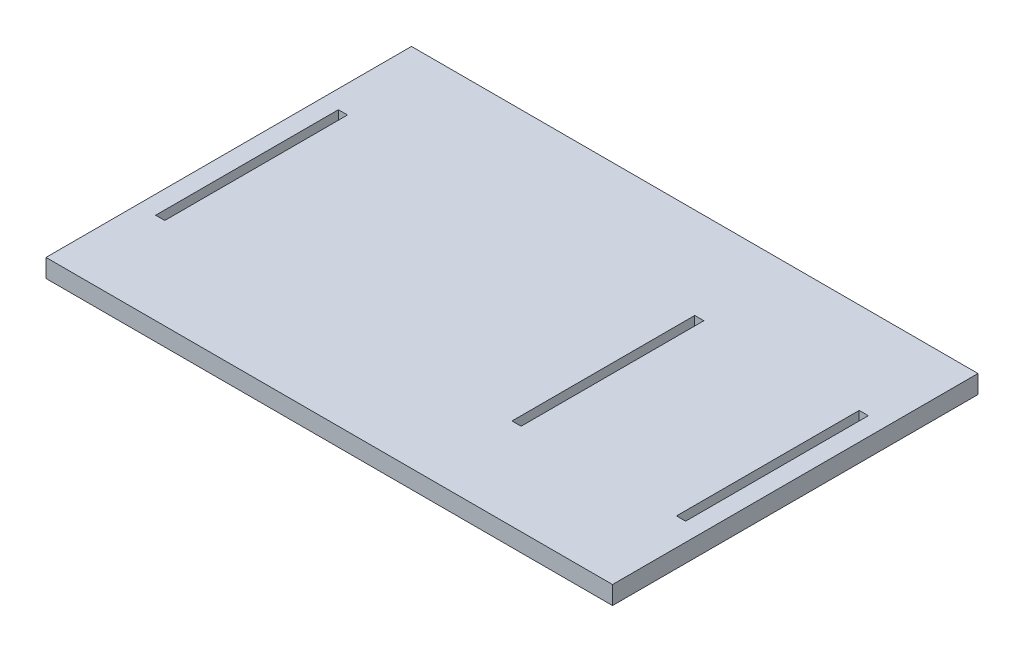
from build123d import *

# Parameters (mm, degrees)
CROQUIS1_W              = 310
CROQUIS1_H              = 200
CROQUIS1_W_2            = 5
CROQUIS1_H_2            = 100
SALIENTE_EXTRUIR1_DEPTH = 10


with BuildPart() as part:
    # Croquis1 → Saliente-Extruir1 (new body)
    with BuildSketch(Plane(origin=(0, 0, 0), x_dir=(1, 0, 0), z_dir=(0, 1, 0))):
        Rectangle(CROQUIS1_W, CROQUIS1_H)
        with Locations((142.5, 0)):
            Rectangle(CROQUIS1_W_2, CROQUIS1_H_2, mode=Mode.SUBTRACT)
        with Locations((-142.5, 0)):
            Rectangle(CROQUIS1_W_2, CROQUIS1_H_2, mode=Mode.SUBTRACT)
        with Locations((52.5, 0)):
            Rectangle(CROQUIS1_W_2, CROQUIS1_H_2, mode=Mode.SUBTRACT)
    extrude(amount=SALIENTE_EXTRUIR1_DEPTH)


solid = part.part
